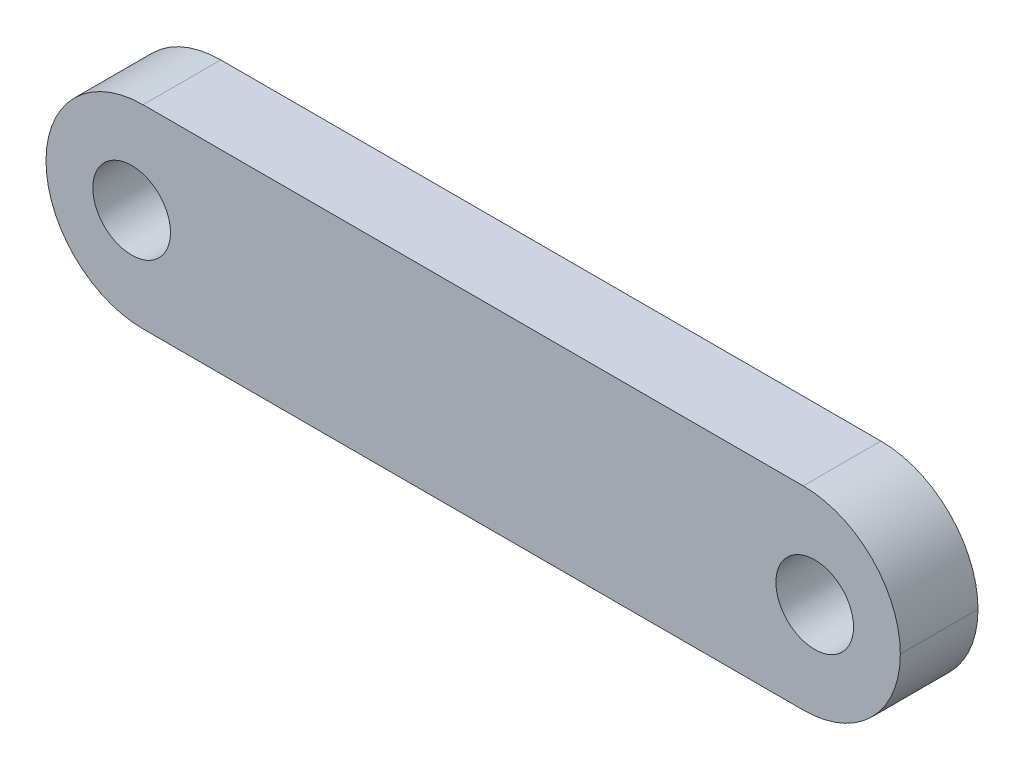
from build123d import *

# Parameters (mm, degrees)
SKETCH1_W           = 22
SKETCH1_H           = 5
SKETCH1_R           = 1
BOSS_EXTRUDE1_DEPTH = 2
FILLET1_R           = 2.5


with BuildPart() as part:
    # Sketch1 → Boss-Extrude1 (new body)
    with BuildSketch(Plane.XY):
        Rectangle(SKETCH1_W, SKETCH1_H)
        with Locations((8.795030905, 0)):
            Circle(SKETCH1_R, mode=Mode.SUBTRACT)
        with Locations(Location((-8.795030905, 0, 0), (0, 0, 180))):
            Circle(SKETCH1_R, mode=Mode.SUBTRACT)
    extrude(amount=BOSS_EXTRUDE1_DEPTH)

    # Fillet1
    fillet1_edges = [part.edges().sort_by_distance(p)[0] for p in [
        (-11, -2.5, 1),
        (-11, 2.5, 1),
        (11, -2.5, 1),
        (11, 2.5, 1),
    ]]
    fillet(fillet1_edges, radius=FILLET1_R - 0.0001)  # a hair under: the kernel refuses the full size


solid = part.part
